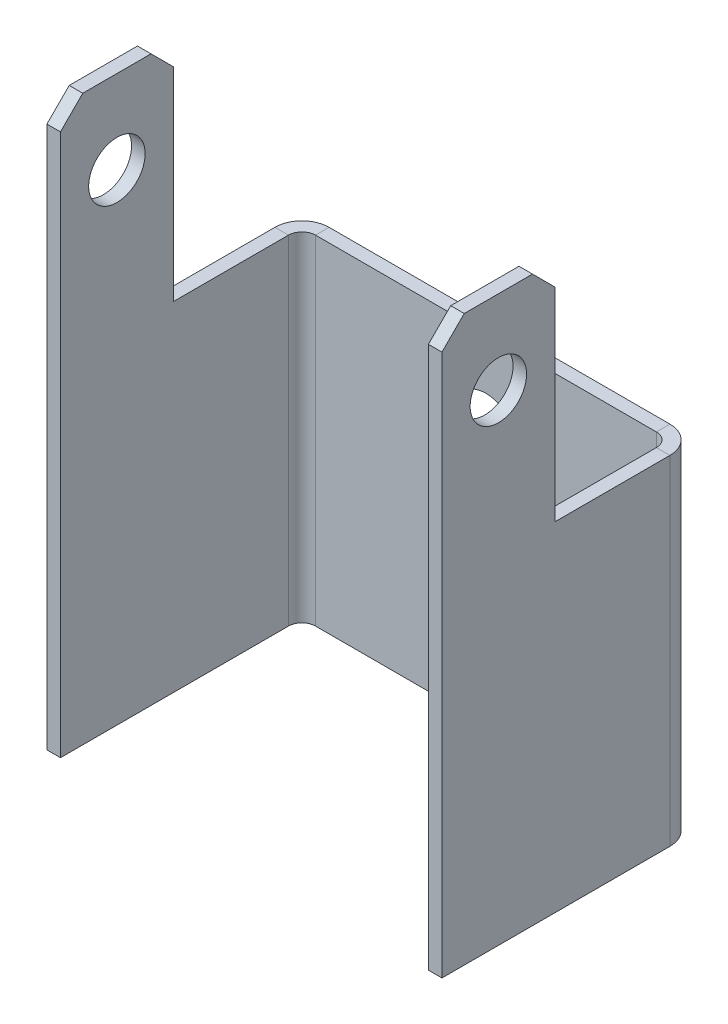
from build123d import *

# Parameters (mm, degrees)
CROQUIS1_W                         = 44.45
CROQUIS1_H                         = 63.5
BRIDA_BASE1_DEPTH                  = 1.524
BRIDA_DE_ARISTA1_STRIP_W           = 9.144
BRIDA_DE_ARISTA1_STRIP_H           = 1.524
BRIDA_DE_ARISTA1_STRIP_CUT_DEPTH   = 63.5
BRIDA_DE_ARISTA1_STRIP_2_W         = 9.144
BRIDA_DE_ARISTA1_STRIP_2_H         = 1.524
BRIDA_DE_ARISTA1_STRIP_CUT_2_DEPTH = 63.5
BRIDA_DE_ARISTA1_DEPTH             = 63.5
BRIDA_DE_ARISTA1_BEND_DEPTH        = 63.5
CROQUIS12_R                        = 3.175
CROQUIS12_W                        = 16.002
CROQUIS12_H                        = 25.4
CORTAR_EXTRUIR1_DEPTH              = 62.738
CROQUIS13_R                        = 3.5687
CORTAR_EXTRUIR2_DEPTH              = 62.738
CORTAR_EXTRUIR3_DEPTH              = 62.738


# Sheet-metal steps are written as plain solids
with BuildPart() as part:
    # Croquis1 → Brida base1 (new body)
    with BuildSketch(Plane.XY):
        Rectangle(CROQUIS1_W, CROQUIS1_H)
    extrude(amount=-BRIDA_BASE1_DEPTH)

    # Brida de arista1 strip (across the edge) → Brida de arista1 strip cut (cut)
    with BuildSketch(Plane(origin=(22.225, -31.75, 0), x_dir=(-1, 0, 0), z_dir=(0, 1, 0))):
        with Locations((-1.524, -0.762)):
            Rectangle(BRIDA_DE_ARISTA1_STRIP_W, BRIDA_DE_ARISTA1_STRIP_H)
    extrude(amount=BRIDA_DE_ARISTA1_STRIP_CUT_DEPTH, mode=Mode.SUBTRACT)

    # Brida de arista1 strip 2 (across the edge) → Brida de arista1 strip cut 2 (cut)
    with BuildSketch(Plane(origin=(-22.225, 31.75, 0), x_dir=(1, 0, 0), z_dir=(0, -1, 0))):
        with Locations((-1.524, -0.762)):
            Rectangle(BRIDA_DE_ARISTA1_STRIP_2_W, BRIDA_DE_ARISTA1_STRIP_2_H)
    extrude(amount=BRIDA_DE_ARISTA1_STRIP_CUT_2_DEPTH, mode=Mode.SUBTRACT)

    # Brida de arista1 section (across the edge) → Brida de arista1 (add)
    with BuildSketch(Plane(origin=(22.225, -31.75, 0), x_dir=(-1, 0, 0), z_dir=(0, 1, 0))):
        with BuildLine():
            Line((0, 1.524), (0, 27.178))
            Line((0, 27.178), (1.524, 27.178))
            Line((1.524, 27.178), (1.524, 1.524))
            ThreePointArc((1.524, 1.524), (1.970369265, 0.446369265), (3.048, 0))
            Line((3.048, 0), (3.048, -1.524))
            ThreePointArc((3.048, -1.524), (0.892738531, -0.631261469), (0, 1.524))
        make_face()
    extrude(amount=BRIDA_DE_ARISTA1_DEPTH)

    # Brida de arista1 section 2 (across the edge) → Brida de arista1 bend (add)
    with BuildSketch(Plane(origin=(-22.225, 31.75, 0), x_dir=(1, 0, 0), z_dir=(0, -1, 0))):
        with BuildLine():
            Line((0, 1.524), (0, 27.178))
            Line((0, 27.178), (1.524, 27.178))
            Line((1.524, 27.178), (1.524, 1.524))
            ThreePointArc((1.524, 1.524), (1.970369265, 0.446369265), (3.048, 0))
            Line((3.048, 0), (3.048, -1.524))
            ThreePointArc((3.048, -1.524), (0.892738531, -0.631261469), (0, 1.524))
        make_face()
    extrude(amount=BRIDA_DE_ARISTA1_BEND_DEPTH)

    # Croquis12 → Cortar-Extruir1 (cut)
    with BuildSketch(Plane(origin=(22.225, 0, 0), x_dir=(0, 0, -1), z_dir=(1, 0, 0))):
        with Locations((-20.828, 22.352)):
            Circle(CROQUIS12_R)
        with Locations((-6.477, 19.05)):
            Rectangle(CROQUIS12_W, CROQUIS12_H)
    extrude(amount=-CORTAR_EXTRUIR1_DEPTH, mode=Mode.SUBTRACT)

    # Croquis13 → Cortar-Extruir2 (cut)
    with BuildSketch(Plane(origin=(0, 0, -1.524), x_dir=(-1, 0, 0), z_dir=(0, 0, -1))):
        with Locations((0, -22.098)):
            Circle(CROQUIS13_R)
        with Locations((0, -3.048)):
            Circle(CROQUIS13_R)
    extrude(amount=-CORTAR_EXTRUIR2_DEPTH, mode=Mode.SUBTRACT)

    # Croquis14 → Cortar-Extruir3 (cut)
    with BuildSketch(Plane(origin=(22.225, 0, 0), x_dir=(0, 0, -1), z_dir=(1, 0, 0))):
        Polygon((-14.478, 31.75), (-16.986914912, 31.75), (-14.478, 29.241085088), align=None)
        Polygon((-27.178, 31.75), (-24.669085088, 31.75), (-27.178, 29.241085088), align=None)
    extrude(amount=-CORTAR_EXTRUIR3_DEPTH, mode=Mode.SUBTRACT)


solid = part.part
